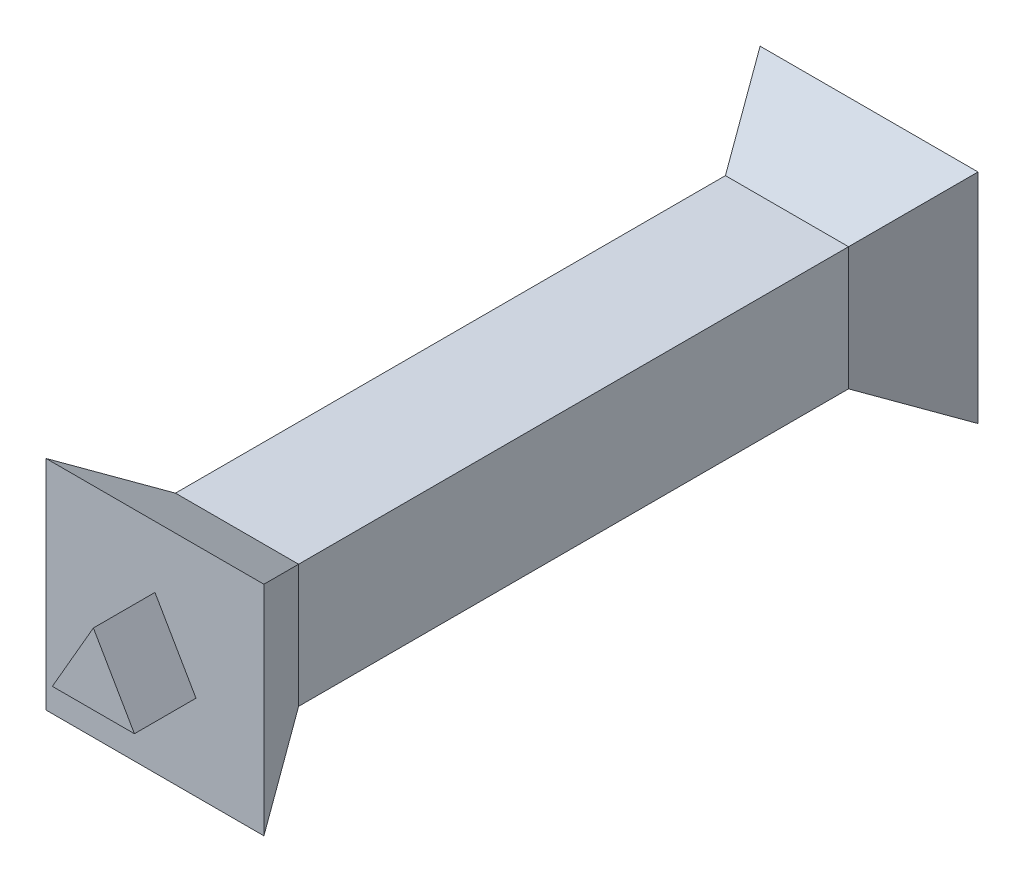
from build123d import *

# Parameters (mm, degrees)
SKETCH1_W               = 3
SKETCH1_H               = 3
BOSS_EXTRUDE1_DEPTH     = 13.4
SKETCH2_W               = 3
SKETCH2_H               = 3
BOSS_EXTRUDE2_DEPTH     = 2
BOSS_EXTRUDE2_DRAFT     = -30
MIRROR1_COPY_1_SKETCH_W = 3
MIRROR1_COPY_1_SKETCH_H = 3
MIRROR1_COPY_1_DEPTH    = 2
MIRROR1_COPY_1_DRAFT    = -30
BOSS_EXTRUDE3_DEPTH     = 1.5


with BuildPart() as part:
    # Sketch1 → Boss-Extrude1 (new body)
    with BuildSketch(Plane.XY):
        Rectangle(SKETCH1_W, SKETCH1_H)
    extrude(amount=BOSS_EXTRUDE1_DEPTH)


with BuildPart() as boss_extrude2_tool:
    # Sketch2 → Boss-Extrude2 (with draft: the straight prism first)
    with BuildSketch(Plane.XY.offset(13.4)):
        Rectangle(SKETCH2_W, SKETCH2_H)
    extrude(amount=BOSS_EXTRUDE2_DEPTH)
    # Boss-Extrude2: the draft: its side faces are tilted about the plane it starts from
    boss_extrude2_sides = [boss_extrude2_tool.faces().sort_by_distance(p)[0] for p in [
        (1.5, 0, 14.4),
        (0, 1.5, 14.4),
        (-1.5, 0, 14.4),
        (0, -1.5, 14.4),
    ]]
    draft(boss_extrude2_sides, Plane.XY.offset(13.4), BOSS_EXTRUDE2_DRAFT)


with BuildPart() as part_1:
    add(part.part)

    # Boss-Extrude2: add boss_extrude2_tool
    add(boss_extrude2_tool.part)


with BuildPart() as mirror1_copy_1_tool:
    # Mirror1 copy 1 sketch → Mirror1 copy 1 (with draft: the straight prism first)
    with BuildSketch(Plane(origin=(0, 0, 0), x_dir=(1, 0, 0), z_dir=(0, 0, -1))):
        Rectangle(MIRROR1_COPY_1_SKETCH_W, MIRROR1_COPY_1_SKETCH_H)
    extrude(amount=MIRROR1_COPY_1_DEPTH)
    # Mirror1 copy 1: the draft: its side faces are tilted about the plane it starts from
    mirror1_copy_1_sides = [mirror1_copy_1_tool.faces().sort_by_distance(p)[0] for p in [
        (1.5, 0, -1),
        (0, 1.5, -1),
        (-1.5, 0, -1),
        (0, -1.5, -1),
    ]]
    draft(mirror1_copy_1_sides, Plane(origin=(0, 0, 0), x_dir=(1, 0, 0), z_dir=(0, 0, -1)), MIRROR1_COPY_1_DRAFT)


with BuildPart() as part_2:
    add(part_1.part)

    # Mirror1 copy 1: add mirror1_copy_1_tool
    add(mirror1_copy_1_tool.part)

    # Sketch3 → Boss-Extrude3 (add)
    with BuildSketch(Plane.XY.offset(15.4)):
        Polygon((0, 1.154700538), (-1, -0.577350269), (1, -0.577350269), align=None)
    boss_extrude3 = extrude(amount=BOSS_EXTRUDE3_DEPTH)

    # Mirror2: Boss-Extrude3 across plane
    add(boss_extrude3.mirror(Plane.XY.offset(6.7)))


solid = part_2.part
